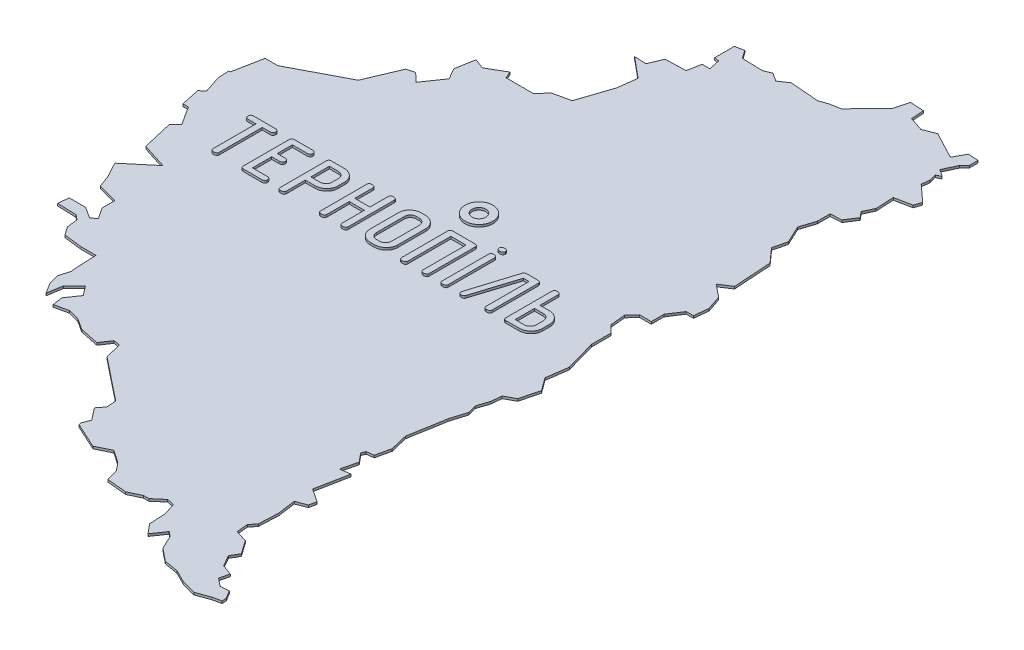
from build123d import *

# Parameters (mm, degrees)
EXTRUDE_1_DEPTH = 5
SKETCH_2_R      = 30
SKETCH_2_R_2    = 15
EXTRUDE_2_DEPTH = 10
SCALE_1_SCALE   = 0.05


with BuildPart() as part:
    # Эскиз1 → Бобышка-Вытянуть1 (new body)
    with BuildSketch(Plane(origin=(0, 0, 0), x_dir=(1, 0, 0), z_dir=(0, 1, 0))):
        Polygon((-3320.1229, 5765.52314), (-3330.51404, 5782.42176), (-3349.31766, 5781.12636), (-3366.19088, 5794.74584), (-3361.00674, 5814.87026), (-3383.7245, 5823.30814), (-3397.34398, 5847.2959), (-3386.95284, 5864.82952), (-3407.07726, 5893.39182), (-3433.02082, 5901.82716), (-3434.97916, 5925.81492), (-3424.58548, 5939.4598), (-3422.65508, 5980.32078), (-3427.83922, 6019.93716), (-3405.78186, 6028.3471), (-3402.52812, 6043.92492), (-3431.09042, 6062.75394), (-3417.44554, 6132.20008), (-3439.5283, 6128.94888), (-3431.09042, 6163.33032), (-3446.66824, 6182.15934), (-3443.4145, 6190.59468), (-3427.83922, 6192.52762), (-3420.69674, 6224.34112), (-3429.76962, 6261.97376), (-3420.69674, 6313.25382), (-3416.17554, 6340.49278), (-3405.78186, 6374.89962), (-3410.966, 6393.70324), (-3402.52812, 6419.0118), (-3400.57232, 6441.09456), (-3378.54036, 6453.41864), (-3368.14922, 6494.27962), (-3388.24824, 6521.54652), (-3381.7687, 6567.6399), (-3400.57232, 6634.46984), (-3400.57232, 6676.65416), (-3416.17554, 6692.20404), (-3419.40134, 6724.65508), (-3403.82606, 6741.52576), (-3378.54036, 6741.52576), (-3378.54036, 6768.79266), (-3359.71134, 6797.98488), (-3344.11066, 6797.98488), (-3340.88232, 6828.4852), (-3351.276, 6859.64592), (-3378.54036, 6881.71852), (-3354.5018, 6897.27348), (-3359.71134, 6979.05132), (-3386.95284, 7009.55164), (-3379.8129, 7038.76164), (-3397.34398, 7076.38666), (-3386.95284, 7108.84278), (-3386.95284, 7136.07666), (-3362.96508, 7137.39238), (-3347.38726, 7161.40046), (-3357.75554, 7173.74486), (-3347.38726, 7195.79206), (-3349.31766, 7234.73788), (-3313.61542, 7241.86766), (-3308.43382, 7257.44548), (-3344.11066, 7289.89144), (-3342.17772, 7306.74942), (-3346.06646, 7322.33486), (-3335.69818, 7326.86114), (-3351.276, 7337.2599), (-3337.63112, 7366.47752), (-3327.26284, 7376.85088), (-3327.26284, 7395.65958), (-3349.31766, 7396.96768), (-3362.96508, 7371.6515), (-3420.69674, 7402.15182), (-3446.66824, 7391.77084), (-3477.16094, 7402.15182), (-3479.11674, 7429.41364), (-3508.32166, 7431.3542), (-3516.757, 7400.86658), (-3571.26286, 7344.3973), (-3593.3253, 7340.5111), (-3612.13908, 7334.01378), (-3673.78996, 7339.20046), (-3693.91184, 7325.5759), (-3711.4353, 7337.2599), (-3728.3136, 7330.76512), (-3772.43086, 7332.0656), (-3784.7651, 7349.5789), (-3803.58142, 7345.70032), (-3803.58142, 7303.50584), (-3793.18266, 7301.57036), (-3788.01122, 7277.56736), (-3804.86412, 7277.56736), (-3810.06604, 7248.35228), (-3854.18584, 7247.05942), (-3866.51754, 7217.84942), (-3892.47888, 7219.15244), (-3886.65212, 7214.59822), (-3847.71138, 7182.16496), (-3852.90568, 7141.2862), (-3876.91122, 7069.24672), (-3914.54386, 7060.81138), (-3931.42724, 7040.69458), (-3991.102, 7040.69458), (-3997.60948, 7055.61454), (-4035.24974, 7033.56734), (-4057.30456, 7041.98998), (-4064.45466, 7001.09852), (-4050.82502, 6977.1006), (-4080.02486, 6934.90866), (-4098.8488, 6953.08236), (-4115.70678, 6948.5383), (-4146.20964, 6876.5166), (-4260.42582, 6816.79866), (-4287.68256, 6816.79866), (-4300.01172, 6753.84984), (-4303.26546, 6753.84984), (-4301.95228, 6729.83668), (-4289.63074, 6692.20404), (-4300.01172, 6683.7941), (-4291.56876, 6642.90772), (-4279.2523, 6642.90772), (-4270.81696, 6629.26284), (-4253.93358, 6603.31674), (-4267.56322, 6589.69726), (-4251.98286, 6523.47692), (-4197.4643, 6505.9941), (-4253.93358, 6458.60278), (-4237.06798, 6427.44968), (-4226.68446, 6400.18278), (-4183.85498, 6388.5191), (-4183.85498, 6361.25474), (-4168.25938, 6337.26698), (-4178.66068, 6328.8037), (-4202.68654, 6344.38152), (-4238.36592, 6344.38152), (-4240.29632, 6321.66376), (-4199.42264, 6320.36836), (-4189.03404, 6311.93302), (-4185.79554, 6287.91986), (-4173.46892, 6270.41164), (-4134.52056, 6265.8625), (-4102.07714, 6265.8625), (-4100.13404, 6224.34112), (-4098.8488, 6209.3983), (-4105.34104, 6185.38514), (-4098.8488, 6163.33032), (-4085.22424, 6141.24756), (-4080.02486, 6173.72146), (-4056.02694, 6197.09962), (-4040.44658, 6176.9498), (-4059.25274, 6149.7083), (-4056.02694, 6127.65348), (-4026.81186, 6134.10762), (-4002.79362, 6127.65348), (-3978.79062, 6112.07566), (-3937.89916, 6103.64032), (-3922.97666, 6125.69514), (-3909.35972, 6123.73934), (-3900.26398, 6088.0371), (-3808.1204, 6014.72762), (-3806.81992, 5993.94026), (-3818.49884, 5979.02538), (-3798.38712, 5953.08182), (-3804.86412, 5936.2086), (-3803.58142, 5931.02446), (-3748.42786, 5905.7159), (-3717.90722, 5920.63078), (-3690.65048, 5901.82716), (-3677.01068, 5884.95394), (-3669.87836, 5859.61998), (-3627.70928, 5855.73124), (-3601.75048, 5868.08072), (-3590.08172, 5868.08072), (-3568.01928, 5886.88434), (-3552.43384, 5883.65854), (-3544.0112, 5857.68958), (-3542.06302, 5821.98734), (-3525.1898, 5801.22538), (-3506.37348, 5828.49228), (-3495.97218, 5820.0544), (-3482.37048, 5790.8317), (-3455.10358, 5768.77688), (-3424.58548, 5763.59274), (-3397.34398, 5749.94786), (-3366.19088, 5741.50998), (-3337.63112, 5751.92906), (-3319.45996, 5755.7924), align=None)
    extrude(amount=EXTRUDE_1_DEPTH)

    # Эскиз2 → Бобышка-Вытянуть2 (add)
    # profile 1 of 11: a face of its own
    with BuildSketch(Plane(origin=(0, 0, 0), x_dir=(1, 0, 0), z_dir=(0, 1, 0))):
        with Locations((-3762.340607285, 6753.252381884)):
            Circle(SKETCH_2_R)
        with Locations((-3762.340607285, 6753.252381884)):
            Circle(SKETCH_2_R_2, mode=Mode.SUBTRACT)
    # profile 2 of 11: a face of its own
    with BuildSketch(Plane(origin=(0, 0, 0), x_dir=(1, 0, 0), z_dir=(0, 1, 0))):
        with BuildLine():
            Line((-4170.036149548, 6679.582542681), (-4187.781081981, 6679.582542681))
            add(Edge.make_bspline(
                [(-4187.781081981, 6679.582542681), (-4188.200828327, 6679.598384207), (-4188.996598969, 6679.628417156), (-4190.106400603, 6679.904019874), (-4191.049244565, 6680.376533147), (-4191.812821275, 6681.055517566), (-4192.431331517, 6681.904459288), (-4192.847685677, 6682.95772022), (-4193.065266496, 6684.187902833), (-4193.103050986, 6685.06310313), (-4193.123142791, 6685.528488627)],
                knots=[0, 0, 0, 0, 1.099344271, 2.084177511, 2.974024668, 3.837303213, 4.738885125, 5.70405988, 6.779139773, 8, 8, 8, 8], degree=3))
            add(Edge.make_bspline(
                [(-4193.123142791, 6685.528488627), (-4193.103050986, 6685.993874124), (-4193.065266496, 6686.869074422), (-4192.847685677, 6688.099257035), (-4192.431331517, 6689.152517966), (-4191.812821275, 6690.001459688), (-4191.049244565, 6690.680444108), (-4190.106400603, 6691.15295738), (-4188.996598969, 6691.428560098), (-4188.200828327, 6691.458593048), (-4187.781081981, 6691.474434573)],
                knots=[0, 0, 0, 0, 1.220860227, 2.29594012, 3.261114875, 4.162696787, 5.025975332, 5.915822489, 6.900655729, 8, 8, 8, 8], degree=3))
            Line((-4187.781081981, 6691.474434573), (-4140.306419818, 6691.474434573))
            add(Edge.make_bspline(
                [(-4140.306419818, 6691.474434573), (-4139.770631248, 6691.459884538), (-4138.768108256, 6691.432659723), (-4137.364579967, 6691.148407714), (-4136.162919764, 6690.699849367), (-4135.173645039, 6690.031445113), (-4134.408335219, 6689.168990841), (-4133.86096206, 6688.118328629), (-4133.570800137, 6686.875191265), (-4133.52521484, 6685.994434789), (-4133.501098872, 6685.528488627)],
                knots=[0, 0, 0, 0, 1.241478992, 2.322952188, 3.306951403, 4.198757046, 5.063935603, 5.955741246, 6.918526805, 8, 8, 8, 8], degree=3))
            add(Edge.make_bspline(
                [(-4133.501098872, 6685.528488627), (-4133.52521484, 6685.062542465), (-4133.570800137, 6684.181785989), (-4133.86096206, 6682.938648626), (-4134.408335219, 6681.887986414), (-4135.173645039, 6681.025532142), (-4136.162919764, 6680.357127888), (-4137.364579967, 6679.908569541), (-4138.768108256, 6679.624317532), (-4139.770631248, 6679.597092717), (-4140.306419818, 6679.582542681)],
                knots=[0, 0, 0, 0, 1.081473195, 2.044258754, 2.936064397, 3.801242954, 4.693048597, 5.677047812, 6.758521008, 8, 8, 8, 8], degree=3))
            Line((-4140.306419818, 6679.582542681), (-4156.65777117, 6679.582542681))
            Line((-4156.65777117, 6679.582542681), (-4156.65777117, 6586.723589979))
            add(Edge.make_bspline(
                [(-4156.65777117, 6586.723589979), (-4156.677253624, 6586.310316247), (-4156.714443056, 6585.521431271), (-4157.074593469, 6584.41973203), (-4157.663302252, 6583.47950466), (-4158.524735618, 6582.744384394), (-4159.590295852, 6582.160519289), (-4160.889696833, 6581.745806074), (-4162.418686627, 6581.532676737), (-4163.508931474, 6581.494688359), (-4164.090203602, 6581.474434573)],
                knots=[0, 0, 0, 0, 0.957214147, 1.827195396, 2.6601552, 3.500842069, 4.426460774, 5.467019893, 6.649522866, 8, 8, 8, 8], degree=3))
            add(Edge.make_bspline(
                [(-4164.090203602, 6581.474434573), (-4164.555493821, 6581.494681406), (-4165.43051494, 6581.53275744), (-4166.661878898, 6581.74841608), (-4167.707103243, 6582.16934975), (-4168.561232095, 6582.759564996), (-4169.248759232, 6583.504385921), (-4169.708866894, 6584.439060975), (-4169.991650016, 6585.530365194), (-4170.020775338, 6586.311340955), (-4170.036149548, 6586.723589979)],
                knots=[0, 0, 0, 0, 1.231142298, 2.315276502, 3.288579949, 4.185921389, 5.041168779, 5.938510218, 6.911813665, 8, 8, 8, 8], degree=3))
            Line((-4170.036149548, 6586.723589979), (-4170.036149548, 6679.582542681))
        make_face()
    # profile 3 of 11: a face of its own
    with BuildSketch(Plane(origin=(0, 0, 0), x_dir=(1, 0, 0), z_dir=(0, 1, 0))):
        with BuildLine():
            Line((-4091.549663062, 6634.987948087), (-4091.549663062, 6593.366326465))
            Line((-4091.549663062, 6593.366326465), (-4059.915372521, 6593.366326465))
            add(Edge.make_bspline(
                [(-4059.915372521, 6593.366326465), (-4059.37998414, 6593.350464604), (-4058.370616604, 6593.320560243), (-4056.961918022, 6593.050642625), (-4055.763820844, 6592.578244841), (-4054.761239426, 6591.932138429), (-4053.994720747, 6591.059812146), (-4053.446495225, 6590.010534281), (-4053.156583521, 6588.76699053), (-4053.110960924, 6587.886294633), (-4053.086825224, 6587.420380519)],
                knots=[0, 0, 0, 0, 1.239032302, 2.335947183, 3.301339876, 4.206248485, 5.069721959, 5.959770044, 6.920658157, 8, 8, 8, 8], degree=3))
            add(Edge.make_bspline(
                [(-4053.086825224, 6587.420380519), (-4053.110960924, 6586.954466405), (-4053.156583521, 6586.073770509), (-4053.446495225, 6584.830226757), (-4053.994720747, 6583.780948893), (-4054.761239426, 6582.90862261), (-4055.763820844, 6582.262516198), (-4056.961918022, 6581.790118414), (-4058.370616604, 6581.520200795), (-4059.37998414, 6581.490296434), (-4059.915372521, 6581.474434573)],
                knots=[0, 0, 0, 0, 1.079341843, 2.040229956, 2.930278041, 3.793751515, 4.698660124, 5.664052817, 6.760967698, 8, 8, 8, 8], degree=3))
            Line((-4059.915372521, 6581.474434573), (-4098.982095494, 6581.474434573))
            add(Edge.make_bspline(
                [(-4098.982095494, 6581.474434573), (-4099.447353918, 6581.494712124), (-4100.322315243, 6581.532845927), (-4101.554073426, 6581.748123694), (-4102.598017928, 6582.170293857), (-4103.461221746, 6582.759686885), (-4104.140677958, 6583.530446712), (-4104.596283298, 6584.479598004), (-4104.886297394, 6585.584122607), (-4104.91353668, 6586.373128189), (-4104.92804144, 6586.793269033)],
                knots=[0, 0, 0, 0, 1.22289028, 2.299757822, 3.266537475, 4.157864275, 5.022578284, 5.932048079, 6.898827733, 8, 8, 8, 8], degree=3))
            Line((-4104.92804144, 6586.793269033), (-4104.92804144, 6686.155600114))
            add(Edge.make_bspline(
                [(-4104.92804144, 6686.155600114), (-4104.91353668, 6686.575740958), (-4104.886297394, 6687.36474654), (-4104.596283298, 6688.469271143), (-4104.140677958, 6689.418422435), (-4103.461221746, 6690.189182261), (-4102.598017928, 6690.778575289), (-4101.554073426, 6691.200745452), (-4100.322315243, 6691.41602322), (-4099.447353918, 6691.454157022), (-4098.982095494, 6691.474434573)],
                knots=[0, 0, 0, 0, 1.101172267, 2.067951921, 2.977421716, 3.842135725, 4.733462525, 5.700242178, 6.77710972, 8, 8, 8, 8], degree=3))
            Line((-4098.982095494, 6691.474434573), (-4059.915372521, 6691.474434573))
            add(Edge.make_bspline(
                [(-4059.915372521, 6691.474434573), (-4059.37998414, 6691.458572712), (-4058.370616604, 6691.428668351), (-4056.961918022, 6691.158750733), (-4055.763820844, 6690.686352949), (-4054.761239426, 6690.040246537), (-4053.994720747, 6689.167920254), (-4053.446495225, 6688.118642389), (-4053.156583521, 6686.875098638), (-4053.110960924, 6685.994402741), (-4053.086825224, 6685.528488627)],
                knots=[0, 0, 0, 0, 1.239032302, 2.335947183, 3.301339876, 4.206248485, 5.069721959, 5.959770044, 6.920658157, 8, 8, 8, 8], degree=3))
            add(Edge.make_bspline(
                [(-4053.086825224, 6685.528488627), (-4053.110960924, 6685.062574514), (-4053.156583521, 6684.181878617), (-4053.446495225, 6682.938334865), (-4053.994720747, 6681.889057001), (-4054.761239426, 6681.016730718), (-4055.763820844, 6680.370624306), (-4056.961918022, 6679.898226522), (-4058.370616604, 6679.628308903), (-4059.37998414, 6679.598404542), (-4059.915372521, 6679.582542681)],
                knots=[0, 0, 0, 0, 1.079341843, 2.040229956, 2.930278041, 3.793751515, 4.698660124, 5.664052817, 6.760967698, 8, 8, 8, 8], degree=3))
            Line((-4059.915372521, 6679.582542681), (-4091.549663062, 6679.582542681))
            Line((-4091.549663062, 6679.582542681), (-4091.549663062, 6646.879839979))
            Line((-4091.549663062, 6646.879839979), (-4075.291217116, 6646.879839979))
            add(Edge.make_bspline(
                [(-4075.291217116, 6646.879839979), (-4074.755828734, 6646.863978118), (-4073.746461198, 6646.834073757), (-4072.337762617, 6646.564156138), (-4071.139665439, 6646.091758354), (-4070.13708402, 6645.445651942), (-4069.370565342, 6644.573325659), (-4068.822339819, 6643.524047795), (-4068.532428115, 6642.280504044), (-4068.486805518, 6641.399808147), (-4068.462669818, 6640.933894033)],
                knots=[0, 0, 0, 0, 1.239032302, 2.335947183, 3.301339876, 4.206248485, 5.069721959, 5.959770044, 6.920658157, 8, 8, 8, 8], degree=3))
            add(Edge.make_bspline(
                [(-4068.462669818, 6640.933894033), (-4068.486805518, 6640.467979919), (-4068.532428115, 6639.587284022), (-4068.822339819, 6638.343740271), (-4069.370565342, 6637.294462406), (-4070.13708402, 6636.422136123), (-4071.139665439, 6635.776029711), (-4072.337762617, 6635.303631927), (-4073.746461198, 6635.033714309), (-4074.755828734, 6635.003809948), (-4075.291217116, 6634.987948087)],
                knots=[0, 0, 0, 0, 1.079341843, 2.040229956, 2.930278041, 3.793751515, 4.698660124, 5.664052817, 6.760967698, 8, 8, 8, 8], degree=3))
            Line((-4075.291217116, 6634.987948087), (-4091.549663062, 6634.987948087))
        make_face()
    # profile 4 of 11: a face of its own
    with BuildSketch(Plane(origin=(0, 0, 0), x_dir=(1, 0, 0), z_dir=(0, 1, 0))):
        with BuildLine():
            Line((-4011.576690089, 6627.555515654), (-4011.576690089, 6586.793269033))
            add(Edge.make_bspline(
                [(-4011.576690089, 6586.793269033), (-4011.59513123, 6586.372014527), (-4011.630025216, 6585.574924562), (-4011.998753487, 6584.461289472), (-4012.581100231, 6583.505474725), (-4013.435687666, 6582.74265732), (-4014.510283185, 6582.161847975), (-4015.808272664, 6581.745379408), (-4017.337710865, 6581.532807712), (-4018.427887018, 6581.494733906), (-4019.009122521, 6581.474434573)],
                knots=[0, 0, 0, 0, 0.969647621, 1.834749252, 2.678145047, 3.526077294, 4.446504318, 5.481227067, 6.657097526, 8, 8, 8, 8], degree=3))
            add(Edge.make_bspline(
                [(-4019.009122521, 6581.474434573), (-4019.474380945, 6581.494712124), (-4020.34934227, 6581.532845927), (-4021.581100453, 6581.748123694), (-4022.625044955, 6582.170293857), (-4023.488248773, 6582.759686885), (-4024.167704985, 6583.530446712), (-4024.623310325, 6584.479598004), (-4024.913324421, 6585.584122607), (-4024.940563707, 6586.373128189), (-4024.955068467, 6586.793269033)],
                knots=[0, 0, 0, 0, 1.22289028, 2.299757822, 3.266537475, 4.157864275, 5.022578284, 5.932048079, 6.898827733, 8, 8, 8, 8], degree=3))
            Line((-4024.955068467, 6586.793269033), (-4024.955068467, 6686.155600114))
            add(Edge.make_bspline(
                [(-4024.955068467, 6686.155600114), (-4024.938686525, 6686.575398792), (-4024.90799535, 6687.361881568), (-4024.644030135, 6688.462421257), (-4024.237558054, 6689.405689167), (-4023.634210951, 6690.186800436), (-4022.842628811, 6690.771668836), (-4021.893829194, 6691.198581253), (-4020.768361821, 6691.417273129), (-4019.969965445, 6691.454527212), (-4019.543328602, 6691.474434573)],
                knots=[0, 0, 0, 0, 1.157077194, 2.167756429, 3.10506564, 3.97280776, 4.857486845, 5.794796055, 6.821611322, 8, 8, 8, 8], degree=3))
            Line((-4019.543328602, 6691.474434573), (-3992.089781305, 6691.474434573))
            add(Edge.make_bspline(
                [(-3992.089781305, 6691.474434573), (-3991.159326913, 6691.454294551), (-3989.33809483, 6691.414873323), (-3986.668441632, 6691.040903849), (-3984.10608727, 6690.513085803), (-3981.677560462, 6689.667757838), (-3979.337567646, 6688.670908172), (-3977.15246713, 6687.35799149), (-3975.046495815, 6685.887580887), (-3973.121492615, 6684.160717648), (-3971.33627823, 6682.325304406), (-3969.782139071, 6680.379073168), (-3968.464978542, 6678.354014913), (-3967.36570633, 6676.269600119), (-3966.519349707, 6674.095776325), (-3965.95081395, 6671.839197636), (-3965.554207395, 6669.523966977), (-3965.515196183, 6667.947815873), (-3965.495609008, 6667.156444708)],
                knots=[0, 0, 0, 0, 1.115359705, 2.183157925, 3.228715987, 4.24774915, 5.262329495, 6.273717254, 7.299288291, 8.338890594, 9.370038504, 10.367862649, 11.320905581, 12.263804873, 13.189908176, 14.111156383, 15.051628764, 16, 16, 16, 16], degree=3))
            Line((-3965.495609008, 6667.156444708), (-3965.495609008, 6651.803826465))
            add(Edge.make_bspline(
                [(-3965.495609008, 6651.803826465), (-3965.51739783, 6651.012816233), (-3965.560550343, 6649.446229542), (-3965.921651657, 6647.134305864), (-3966.501394376, 6644.891857766), (-3967.321904205, 6642.721138736), (-3968.366015911, 6640.623154251), (-3969.668394769, 6638.61296778), (-3971.170062014, 6636.657600864), (-3972.912836682, 6634.824989227), (-3974.783271571, 6633.096071995), (-3976.850427602, 6631.648174052), (-3978.994430259, 6630.363387072), (-3981.287242723, 6629.355760324), (-3983.681279735, 6628.521901544), (-3986.21067827, 6627.985655596), (-3988.842716999, 6627.616745563), (-3990.640664377, 6627.576165428), (-3991.555575224, 6627.555515654)],
                knots=[0, 0, 0, 0, 0.959067182, 1.899421552, 2.831059805, 3.764258791, 4.709244439, 5.667943704, 6.665417502, 7.695258647, 8.732566372, 9.748959613, 10.750800674, 11.759659972, 12.7812896, 13.820296438, 14.890827142, 16, 16, 16, 16], degree=3))
            Line((-3991.555575224, 6627.555515654), (-4011.576690089, 6627.555515654))
        make_face()
        with BuildLine():
            Line((-4011.576690089, 6639.447407546), (-3992.298818467, 6639.447407546))
            add(Edge.make_bspline(
                [(-3992.298818467, 6639.447407546), (-3991.410683453, 6639.487423827), (-3989.665439211, 6639.566058475), (-3987.168478388, 6640.326446837), (-3984.852633531, 6641.509954904), (-3982.803380026, 6643.150668856), (-3981.057864009, 6645.090441674), (-3979.794765588, 6647.30715897), (-3979.020491517, 6649.717124559), (-3978.923219326, 6651.395605207), (-3978.873987386, 6652.245127141)],
                knots=[0, 0, 0, 0, 1.033886494, 2.031655573, 3.017574438, 4.053235711, 5.077365722, 6.044435782, 7.010238993, 8, 8, 8, 8], degree=3))
            Line((-3978.873987386, 6652.245127141), (-3978.873987386, 6666.715144033))
            add(Edge.make_bspline(
                [(-3978.873987386, 6666.715144033), (-3978.923796867, 6667.564329149), (-3979.022210159, 6669.242144314), (-3979.789261582, 6671.660732875), (-3981.090962113, 6673.86635653), (-3982.822129054, 6675.824542592), (-3984.858194525, 6677.508281068), (-3987.175575315, 6678.695824231), (-3989.672108594, 6679.46681821), (-3991.41042077, 6679.543402708), (-3992.298818467, 6679.582542681)],
                knots=[0, 0, 0, 0, 0.988107596, 1.952297418, 2.922249424, 3.951448995, 4.983962972, 5.98039188, 6.967840629, 8, 8, 8, 8], degree=3))
            Line((-3992.298818467, 6679.582542681), (-4011.576690089, 6679.582542681))
            Line((-4011.576690089, 6679.582542681), (-4011.576690089, 6639.447407546))
        make_face(mode=Mode.SUBTRACT)
    # profile 5 of 11: a face of its own
    with BuildSketch(Plane(origin=(0, 0, 0), x_dir=(1, 0, 0), z_dir=(0, 1, 0))):
        with BuildLine():
            Line((-3891.468581981, 6646.879839979), (-3891.468581981, 6686.271731871))
            add(Edge.make_bspline(
                [(-3891.468581981, 6686.271731871), (-3891.454173, 6686.68423533), (-3891.427138367, 6687.458188718), (-3891.136479135, 6688.539293106), (-3890.681750486, 6689.46839126), (-3889.992812688, 6690.210357794), (-3889.145009803, 6690.809862843), (-3888.085293026, 6691.185136569), (-3886.868007415, 6691.455891147), (-3885.989011259, 6691.468006464), (-3885.522636035, 6691.474434573)],
                knots=[0, 0, 0, 0, 1.091529518, 2.047965782, 2.948064081, 3.805939007, 4.706037306, 5.674741692, 6.76627121, 8, 8, 8, 8], degree=3))
            add(Edge.make_bspline(
                [(-3885.522636035, 6691.474434573), (-3884.941400532, 6691.454135241), (-3883.851224378, 6691.416061435), (-3882.321786178, 6691.203489738), (-3881.023796698, 6690.787021171), (-3879.949201179, 6690.206211827), (-3879.094613744, 6689.443394422), (-3878.512267001, 6688.487579675), (-3878.143538729, 6687.373944585), (-3878.108644744, 6686.576854619), (-3878.090203602, 6686.155600114)],
                knots=[0, 0, 0, 0, 1.342902474, 2.518772933, 3.553495682, 4.473922706, 5.321854953, 6.165250748, 7.030352379, 8, 8, 8, 8], degree=3))
            Line((-3878.090203602, 6686.155600114), (-3878.090203602, 6586.793269033))
            add(Edge.make_bspline(
                [(-3878.090203602, 6586.793269033), (-3878.108644744, 6586.372014527), (-3878.143538729, 6585.574924562), (-3878.512267001, 6584.461289472), (-3879.094613744, 6583.505474725), (-3879.949201179, 6582.74265732), (-3881.023796698, 6582.161847975), (-3882.321786178, 6581.745379408), (-3883.851224378, 6581.532807712), (-3884.941400532, 6581.494733906), (-3885.522636035, 6581.474434573)],
                knots=[0, 0, 0, 0, 0.969647621, 1.834749252, 2.678145047, 3.526077294, 4.446504318, 5.481227067, 6.657097526, 8, 8, 8, 8], degree=3))
            add(Edge.make_bspline(
                [(-3885.522636035, 6581.474434573), (-3885.987894459, 6581.494712124), (-3886.862855783, 6581.532845927), (-3888.094613967, 6581.748123694), (-3889.138558468, 6582.170293857), (-3890.001762287, 6582.759686885), (-3890.681218498, 6583.530446712), (-3891.136823839, 6584.479598004), (-3891.426837934, 6585.584122607), (-3891.45407722, 6586.373128189), (-3891.468581981, 6586.793269033)],
                knots=[0, 0, 0, 0, 1.22289028, 2.299757822, 3.266537475, 4.157864275, 5.022578284, 5.932048079, 6.898827733, 8, 8, 8, 8], degree=3))
            Line((-3891.468581981, 6586.793269033), (-3891.468581981, 6634.987948087))
            Line((-3891.468581981, 6634.987948087), (-3924.171284683, 6634.987948087))
            Line((-3924.171284683, 6634.987948087), (-3924.171284683, 6586.793269033))
            add(Edge.make_bspline(
                [(-3924.171284683, 6586.793269033), (-3924.189725825, 6586.372014527), (-3924.22461981, 6585.574924562), (-3924.593348082, 6584.461289472), (-3925.175694825, 6583.505474725), (-3926.03028226, 6582.74265732), (-3927.104877779, 6582.161847975), (-3928.402867259, 6581.745379408), (-3929.93230546, 6581.532807712), (-3931.022481613, 6581.494733906), (-3931.603717116, 6581.474434573)],
                knots=[0, 0, 0, 0, 0.969647621, 1.834749252, 2.678145047, 3.526077294, 4.446504318, 5.481227067, 6.657097526, 8, 8, 8, 8], degree=3))
            add(Edge.make_bspline(
                [(-3931.603717116, 6581.474434573), (-3932.06897554, 6581.494712124), (-3932.943936864, 6581.532845927), (-3934.175695048, 6581.748123694), (-3935.219639549, 6582.170293857), (-3936.082843368, 6582.759686885), (-3936.762299579, 6583.530446712), (-3937.21790492, 6584.479598004), (-3937.507919015, 6585.584122607), (-3937.535158302, 6586.373128189), (-3937.549663062, 6586.793269033)],
                knots=[0, 0, 0, 0, 1.22289028, 2.299757822, 3.266537475, 4.157864275, 5.022578284, 5.932048079, 6.898827733, 8, 8, 8, 8], degree=3))
            Line((-3937.549663062, 6586.793269033), (-3937.549663062, 6686.155600114))
            add(Edge.make_bspline(
                [(-3937.549663062, 6686.155600114), (-3937.535158302, 6686.575740958), (-3937.507919015, 6687.36474654), (-3937.21790492, 6688.469271143), (-3936.762299579, 6689.418422435), (-3936.082843368, 6690.189182261), (-3935.219639549, 6690.778575289), (-3934.175695048, 6691.200745452), (-3932.943936864, 6691.41602322), (-3932.06897554, 6691.454157022), (-3931.603717116, 6691.474434573)],
                knots=[0, 0, 0, 0, 1.101172267, 2.067951921, 2.977421716, 3.842135725, 4.733462525, 5.700242178, 6.77710972, 8, 8, 8, 8], degree=3))
            add(Edge.make_bspline(
                [(-3931.603717116, 6691.474434573), (-3931.021533005, 6691.468196673), (-3929.928024176, 6691.456480107), (-3928.410744278, 6691.186757161), (-3927.099248042, 6690.819111516), (-3926.038954438, 6690.225682012), (-3925.176188558, 6689.493246495), (-3924.593913164, 6688.55797041), (-3924.22434409, 6687.46755988), (-3924.189637811, 6686.68536606), (-3924.171284683, 6686.271731871)],
                knots=[0, 0, 0, 0, 1.353106154, 2.541521659, 3.579288285, 4.507284885, 5.350131461, 6.185231121, 7.040326791, 8, 8, 8, 8], degree=3))
            Line((-3924.171284683, 6686.271731871), (-3924.171284683, 6646.879839979))
            Line((-3924.171284683, 6646.879839979), (-3891.468581981, 6646.879839979))
        make_face()
    # profile 6 of 11: a face of its own
    with BuildSketch(Plane(origin=(0, 0, 0), x_dir=(1, 0, 0), z_dir=(0, 1, 0))):
        with BuildLine():
            add(Edge.make_bspline(
                [(-3790.684798197, 6605.885329844), (-3790.707366726, 6605.086789004), (-3790.752065517, 6603.505214448), (-3791.100997811, 6601.172759603), (-3791.721401424, 6598.920511589), (-3792.550579132, 6596.736670965), (-3793.633401826, 6594.631237249), (-3794.942909008, 6592.603387664), (-3796.485103564, 6590.638973539), (-3798.257202697, 6588.788954516), (-3800.19000102, 6587.062109191), (-3802.294948932, 6585.590501118), (-3804.480567377, 6584.27865458), (-3806.82625659, 6583.275804657), (-3809.265834577, 6582.440381488), (-3811.84155949, 6581.904754951), (-3814.519833785, 6581.535685308), (-3816.348594061, 6581.495088222), (-3817.278970494, 6581.474434573)],
                knots=[0, 0, 0, 0, 0.955175484, 1.891802106, 2.813050817, 3.745408234, 4.681622557, 5.639981446, 6.629481268, 7.664661711, 8.701581189, 9.72450561, 10.733283354, 11.745245447, 12.770431959, 13.813291825, 14.887518622, 16, 16, 16, 16], degree=3))
            Line((-3817.278970494, 6581.474434573), (-3825.129477251, 6581.474434573))
            add(Edge.make_bspline(
                [(-3825.129477251, 6581.474434573), (-3825.974419733, 6581.49792441), (-3827.639638183, 6581.544218342), (-3830.098049683, 6581.876847013), (-3832.467050648, 6582.424830585), (-3834.732736577, 6583.229570889), (-3836.91068823, 6584.225858494), (-3838.979047573, 6585.470479362), (-3840.968816749, 6586.915303528), (-3842.829062728, 6588.578464548), (-3844.538319859, 6590.39246039), (-3846.028376792, 6592.336339366), (-3847.325295201, 6594.351036241), (-3848.338958529, 6596.490552112), (-3849.174169465, 6598.697786703), (-3849.712333536, 6601.018990021), (-3850.082362239, 6603.419206892), (-3850.123429445, 6605.055463418), (-3850.144257656, 6605.885329844)],
                knots=[0, 0, 0, 0, 1.043149238, 2.055845687, 3.05760797, 4.040256608, 5.019784463, 6.010076682, 7.015890737, 8.051962927, 9.086799385, 10.08878973, 11.072786086, 12.039115508, 13.007004251, 13.980870723, 14.97595055, 16, 16, 16, 16], degree=3))
            Line((-3850.144257656, 6605.885329844), (-3850.144257656, 6667.063539303))
            add(Edge.make_bspline(
                [(-3850.144257656, 6667.063539303), (-3850.12323513, 6667.893358606), (-3850.081784788, 6669.529522219), (-3849.715687201, 6671.922965167), (-3849.169836705, 6674.234510526), (-3848.339409938, 6676.435204505), (-3847.325150617, 6678.574545599), (-3846.028498541, 6680.589434995), (-3844.537969815, 6682.532703041), (-3842.830382992, 6684.349024425), (-3840.960522523, 6686.006580407), (-3838.983669036, 6687.488946104), (-3836.890203718, 6688.714870337), (-3834.710488913, 6689.72112671), (-3832.450324704, 6690.519516857), (-3830.091138303, 6691.075293431), (-3827.639489705, 6691.404061257), (-3825.974369754, 6691.450746289), (-3825.129477251, 6691.474434573)],
                knots=[0, 0, 0, 0, 1.024350526, 2.019722912, 2.984584598, 3.952757905, 4.919371433, 5.90365709, 6.905942025, 7.941082731, 8.977459532, 9.989234251, 10.988046002, 11.967861842, 12.950799385, 13.943549883, 14.95654407, 16, 16, 16, 16], degree=3))
            Line((-3825.129477251, 6691.474434573), (-3817.278970494, 6691.474434573))
            add(Edge.make_bspline(
                [(-3817.278970494, 6691.474434573), (-3816.348828657, 6691.452860665), (-3814.520529507, 6691.410454703), (-3811.837248247, 6691.054245218), (-3809.281625263, 6690.472504284), (-3806.830871348, 6689.684709947), (-3804.518552103, 6688.633307481), (-3802.302291654, 6687.368364976), (-3800.222506015, 6685.857917669), (-3798.277436128, 6684.140128118), (-3796.510923691, 6682.278198536), (-3794.94077636, 6680.330235482), (-3793.633794451, 6678.293689676), (-3792.556780032, 6676.194524338), (-3791.711702212, 6674.016018401), (-3791.108259643, 6671.766632504), (-3790.74955633, 6669.436445778), (-3790.706595004, 6667.862231022), (-3790.684798197, 6667.063539303)],
                knots=[0, 0, 0, 0, 1.113057418, 2.187840446, 3.233255027, 4.247266833, 5.263520674, 6.268172433, 7.297024944, 8.334481335, 9.370197792, 10.365962262, 11.324817386, 12.261516479, 13.185708152, 14.116382211, 15.044329928, 16, 16, 16, 16], degree=3))
            Line((-3790.684798197, 6667.063539303), (-3790.684798197, 6605.885329844))
        make_face()
        with BuildLine():
            Line((-3804.063176575, 6606.744704844), (-3804.063176575, 6666.204164303))
            add(Edge.make_bspline(
                [(-3804.063176575, 6666.204164303), (-3804.111084054, 6667.100115402), (-3804.204908478, 6668.854791252), (-3804.98269475, 6671.370671283), (-3806.242507212, 6673.680317976), (-3807.980774479, 6675.705186542), (-3810.022876337, 6677.430935217), (-3812.335321131, 6678.688006467), (-3814.85719604, 6679.431953804), (-3816.600507282, 6679.531741748), (-3817.488007656, 6679.582542681)],
                knots=[0, 0, 0, 0, 1.020875316, 1.999333742, 2.976114742, 4.00461091, 5.027434937, 6.011979822, 6.987921027, 8, 8, 8, 8], degree=3))
            Line((-3817.488007656, 6679.582542681), (-3824.897213737, 6679.582542681))
            add(Edge.make_bspline(
                [(-3824.897213737, 6679.582542681), (-3825.62253308, 6679.537129393), (-3827.083502535, 6679.445655992), (-3829.221009674, 6678.709303398), (-3831.232051615, 6677.485135576), (-3833.11816907, 6675.879148023), (-3834.752445095, 6673.903883949), (-3835.928618305, 6671.572275658), (-3836.644632831, 6668.971315549), (-3836.724626251, 6667.145662943), (-3836.765879278, 6666.204164303)],
                knots=[0, 0, 0, 0, 0.877717203, 1.767935789, 2.706167804, 3.717871189, 4.758407714, 5.790788373, 6.860697959, 8, 8, 8, 8], degree=3))
            Line((-3836.765879278, 6666.204164303), (-3836.765879278, 6606.744704844))
            add(Edge.make_bspline(
                [(-3836.765879278, 6606.744704844), (-3836.72653301, 6605.794956606), (-3836.650847816, 6603.968051979), (-3835.917790256, 6601.365692596), (-3834.760659964, 6599.024914942), (-3833.11601989, 6597.049126192), (-3831.239649817, 6595.435209226), (-3829.219528862, 6594.24991255), (-3827.093723541, 6593.495820249), (-3825.630962573, 6593.409584143), (-3824.897213737, 6593.366326465)],
                knots=[0, 0, 0, 0, 1.148029747, 2.20831245, 3.248494772, 4.28846567, 5.299619101, 6.232592159, 7.113434475, 8, 8, 8, 8], degree=3))
            Line((-3824.897213737, 6593.366326465), (-3817.488007656, 6593.366326465))
            add(Edge.make_bspline(
                [(-3817.488007656, 6593.366326465), (-3816.592812632, 6593.416626935), (-3814.841824842, 6593.515013886), (-3812.310639735, 6594.25934688), (-3810.009596735, 6595.521491852), (-3807.946975333, 6597.21061019), (-3806.244803686, 6599.265682521), (-3804.952055258, 6601.561126614), (-3804.213226319, 6604.099207372), (-3804.113937915, 6605.849741669), (-3804.063176575, 6606.744704844)],
                knots=[0, 0, 0, 0, 1.019985615, 1.995076279, 2.978763126, 3.995073656, 5.017006284, 6.004923721, 6.980014385, 8, 8, 8, 8], degree=3))
        make_face(mode=Mode.SUBTRACT)
    # profile 7 of 11: a face of its own
    with BuildSketch(Plane(origin=(0, 0, 0), x_dir=(1, 0, 0), z_dir=(0, 1, 0))):
        with BuildLine():
            add(Edge.make_bspline(
                [(-3703.279392791, 6586.793269033), (-3703.297833933, 6586.372014527), (-3703.332727919, 6585.574924562), (-3703.70145619, 6584.461289472), (-3704.283802933, 6583.505474725), (-3705.138390368, 6582.74265732), (-3706.212985887, 6582.161847975), (-3707.510975367, 6581.745379408), (-3709.040413568, 6581.532807712), (-3710.130589721, 6581.494733906), (-3710.711825224, 6581.474434573)],
                knots=[0, 0, 0, 0, 0.969647621, 1.834749252, 2.678145047, 3.526077294, 4.446504318, 5.481227067, 6.657097526, 8, 8, 8, 8], degree=3))
            add(Edge.make_bspline(
                [(-3710.711825224, 6581.474434573), (-3711.177115443, 6581.494681406), (-3712.052136561, 6581.53275744), (-3713.283500519, 6581.74841608), (-3714.328724865, 6582.16934975), (-3715.182853717, 6582.759564996), (-3715.870380854, 6583.504385921), (-3716.330488515, 6584.439060975), (-3716.613271638, 6585.530365194), (-3716.64239696, 6586.311340955), (-3716.65777117, 6586.723589979)],
                knots=[0, 0, 0, 0, 1.231142298, 2.315276502, 3.288579949, 4.185921389, 5.041168779, 5.938510218, 6.911813665, 8, 8, 8, 8], degree=3))
            Line((-3716.65777117, 6586.723589979), (-3716.65777117, 6679.582542681))
            Line((-3716.65777117, 6679.582542681), (-3749.360473872, 6679.582542681))
            Line((-3749.360473872, 6679.582542681), (-3749.360473872, 6586.723589979))
            add(Edge.make_bspline(
                [(-3749.360473872, 6586.723589979), (-3749.379956327, 6586.310316247), (-3749.417145759, 6585.521431271), (-3749.777296172, 6584.41973203), (-3750.366004955, 6583.47950466), (-3751.22743832, 6582.744384394), (-3752.292998555, 6582.160519289), (-3753.592399536, 6581.745806074), (-3755.12138933, 6581.532676737), (-3756.211634177, 6581.494688359), (-3756.792906305, 6581.474434573)],
                knots=[0, 0, 0, 0, 0.957214147, 1.827195396, 2.6601552, 3.500842069, 4.426460774, 5.467019893, 6.649522866, 8, 8, 8, 8], degree=3))
            add(Edge.make_bspline(
                [(-3756.792906305, 6581.474434573), (-3757.258164729, 6581.494712124), (-3758.133126053, 6581.532845927), (-3759.364884237, 6581.748123694), (-3760.408828738, 6582.170293857), (-3761.272032557, 6582.759686885), (-3761.951488768, 6583.530446712), (-3762.407094109, 6584.479598004), (-3762.697108204, 6585.584122607), (-3762.724347491, 6586.373128189), (-3762.738852251, 6586.793269033)],
                knots=[0, 0, 0, 0, 1.22289028, 2.299757822, 3.266537475, 4.157864275, 5.022578284, 5.932048079, 6.898827733, 8, 8, 8, 8], degree=3))
            Line((-3762.738852251, 6586.793269033), (-3762.738852251, 6686.155600114))
            add(Edge.make_bspline(
                [(-3762.738852251, 6686.155600114), (-3762.722470309, 6686.575398792), (-3762.691779133, 6687.361881568), (-3762.427813919, 6688.462421257), (-3762.021341837, 6689.405689167), (-3761.417994735, 6690.186800436), (-3760.626412595, 6690.771668836), (-3759.677612978, 6691.198581253), (-3758.552145605, 6691.417273129), (-3757.753749229, 6691.454527212), (-3757.327112386, 6691.474434573)],
                knots=[0, 0, 0, 0, 1.157077194, 2.167756429, 3.10506564, 3.97280776, 4.857486845, 5.794796055, 6.821611322, 8, 8, 8, 8], degree=3))
            Line((-3757.327112386, 6691.474434573), (-3710.177619143, 6691.474434573))
            add(Edge.make_bspline(
                [(-3710.177619143, 6691.474434573), (-3709.635054989, 6691.454409429), (-3708.621788857, 6691.417011455), (-3707.199117399, 6691.202370942), (-3705.995355566, 6690.782030135), (-3704.992414545, 6690.206120582), (-3704.210363272, 6689.431629739), (-3703.679201031, 6688.479557594), (-3703.3378778, 6687.370424165), (-3703.299653387, 6686.576444015), (-3703.279392791, 6686.155600114)],
                knots=[0, 0, 0, 0, 1.311732788, 2.449727646, 3.461545579, 4.37596936, 5.222620336, 6.085851813, 6.985418475, 8, 8, 8, 8], degree=3))
            Line((-3703.279392791, 6686.155600114), (-3703.279392791, 6586.793269033))
        make_face()
    # profile 8 of 11: a face of its own
    with BuildSketch(Plane(origin=(0, 0, 0), x_dir=(1, 0, 0), z_dir=(0, 1, 0))):
        with BuildLine():
            add(Edge.make_bspline(
                [(-3661.955068467, 6586.816495384), (-3661.975032766, 6586.395808084), (-3662.013159197, 6585.5924087), (-3662.365190176, 6584.471028713), (-3662.967417855, 6583.525016198), (-3663.819205652, 6582.768632321), (-3664.881332243, 6582.156144433), (-3666.187826815, 6581.747579247), (-3667.715728313, 6581.53213242), (-3668.806139882, 6581.494499072), (-3669.387500899, 6581.474434573)],
                knots=[0, 0, 0, 0, 0.968349646, 1.849286893, 2.676465977, 3.523263178, 4.451261044, 5.484598709, 6.658895142, 8, 8, 8, 8], degree=3))
            add(Edge.make_bspline(
                [(-3669.387500899, 6581.474434573), (-3669.852886396, 6581.494526378), (-3670.728086694, 6581.532310868), (-3671.958269307, 6581.749891688), (-3673.011530239, 6582.166245848), (-3673.860471961, 6582.78475609), (-3674.53945638, 6583.5483328), (-3675.011969653, 6584.491176762), (-3675.28757237, 6585.600978396), (-3675.31760532, 6586.396749037), (-3675.333446845, 6586.816495384)],
                knots=[0, 0, 0, 0, 1.220860227, 2.29594012, 3.261114875, 4.162696787, 5.025975332, 5.915822489, 6.900655729, 8, 8, 8, 8], degree=3))
            Line((-3675.333446845, 6586.816495384), (-3675.333446845, 6686.829164303))
            add(Edge.make_bspline(
                [(-3675.333446845, 6686.829164303), (-3675.317429528, 6687.248742345), (-3675.287063305, 6688.04419391), (-3675.013689804, 6689.156129809), (-3674.531052628, 6690.097119052), (-3673.876299285, 6690.88637081), (-3673.002017195, 6691.474269499), (-3671.959914306, 6691.897875522), (-3670.727588858, 6692.112711007), (-3669.852713572, 6692.150911892), (-3669.387500899, 6692.171225114)],
                knots=[0, 0, 0, 0, 1.098843442, 2.08322802, 2.972669788, 3.850929026, 4.740370794, 5.705105844, 6.779695961, 8, 8, 8, 8], degree=3))
            add(Edge.make_bspline(
                [(-3669.387500899, 6692.171225114), (-3668.806323977, 6692.15086938), (-3667.7162577, 6692.112689786), (-3666.186102277, 6691.900808627), (-3664.890370479, 6691.482166377), (-3663.803931678, 6690.905748334), (-3662.975498957, 6690.118982503), (-3662.363725656, 6689.176360056), (-3662.01357856, 6688.052755868), (-3661.97517689, 6687.249681443), (-3661.955068467, 6686.829164303)],
                knots=[0, 0, 0, 0, 1.340544031, 2.514349394, 3.547254935, 4.466065479, 5.324653274, 6.151486447, 7.032055301, 8, 8, 8, 8], degree=3))
            Line((-3661.955068467, 6686.829164303), (-3661.955068467, 6586.816495384))
        make_face()
    # profile 9 of 11: a face of its own
    with BuildSketch(Plane(origin=(0, 0, 0), x_dir=(1, 0, 0), z_dir=(0, 1, 0))):
        with BuildLine():
            add(Edge.make_bspline(
                [(-3669.387500899, 6715.258218357), (-3668.806265396, 6715.237919025), (-3667.716089243, 6715.199845218), (-3666.186651043, 6714.987273522), (-3664.888661563, 6714.570804955), (-3663.814066044, 6713.98999561), (-3662.959478609, 6713.227178206), (-3662.377131866, 6712.271363459), (-3662.008403594, 6711.157728369), (-3661.973509608, 6710.360638403), (-3661.955068467, 6709.939383898)],
                knots=[0, 0, 0, 0, 1.342902474, 2.518772933, 3.553495682, 4.473922706, 5.321854953, 6.165250748, 7.030352379, 8, 8, 8, 8], degree=3))
            add(Edge.make_bspline(
                [(-3661.955068467, 6709.939383898), (-3661.974029149, 6709.510756162), (-3662.009927915, 6708.699223778), (-3662.370226422, 6707.56546646), (-3662.967189249, 6706.605404253), (-3663.805006098, 6705.817346582), (-3664.889800265, 6705.238167574), (-3666.188522357, 6704.828000164), (-3667.713530652, 6704.577169362), (-3668.805805136, 6704.544853822), (-3669.387500899, 6704.527644033)],
                knots=[0, 0, 0, 0, 0.981339183, 1.857995784, 2.696169867, 3.550943068, 4.465671455, 5.493987931, 6.665411832, 8, 8, 8, 8], degree=3))
            add(Edge.make_bspline(
                [(-3669.387500899, 6704.527644033), (-3669.853338207, 6704.544904815), (-3670.730921413, 6704.577422118), (-3671.956976364, 6704.830777939), (-3673.002578143, 6705.246057859), (-3673.875445783, 6705.836527793), (-3674.538412113, 6706.628810939), (-3675.00776885, 6707.584566757), (-3675.290207093, 6708.70806399), (-3675.318431142, 6709.511788147), (-3675.333446845, 6709.939383898)],
                knots=[0, 0, 0, 0, 1.213876563, 2.286801999, 3.246455683, 4.131212664, 5.004846013, 5.90761226, 6.886811976, 8, 8, 8, 8], degree=3))
            add(Edge.make_bspline(
                [(-3675.333446845, 6709.939383898), (-3675.318942085, 6710.359524742), (-3675.291702799, 6711.148530324), (-3675.001688703, 6712.253054926), (-3674.546083363, 6713.202206219), (-3673.866627151, 6713.972966045), (-3673.003423333, 6714.562359073), (-3671.959478832, 6714.984529236), (-3670.727720648, 6715.199807004), (-3669.852759323, 6715.237940806), (-3669.387500899, 6715.258218357)],
                knots=[0, 0, 0, 0, 1.101172267, 2.067951921, 2.977421716, 3.842135725, 4.733462525, 5.700242178, 6.77710972, 8, 8, 8, 8], degree=3))
        make_face()
    # profile 10 of 11: a face of its own
    with BuildSketch(Plane(origin=(0, 0, 0), x_dir=(1, 0, 0), z_dir=(0, 1, 0))):
        with BuildLine():
            add(Edge.make_bspline(
                [(-3567.117230629, 6586.793269033), (-3567.135671771, 6586.372014527), (-3567.170565756, 6585.574924562), (-3567.539294028, 6584.461289472), (-3568.121640771, 6583.505474725), (-3568.976228206, 6582.74265732), (-3570.050823725, 6582.161847975), (-3571.348813205, 6581.745379408), (-3572.878251405, 6581.532807712), (-3573.968427559, 6581.494733906), (-3574.549663062, 6581.474434573)],
                knots=[0, 0, 0, 0, 0.969647621, 1.834749252, 2.678145047, 3.526077294, 4.446504318, 5.481227067, 6.657097526, 8, 8, 8, 8], degree=3))
            add(Edge.make_bspline(
                [(-3574.549663062, 6581.474434573), (-3575.014953281, 6581.494681406), (-3575.889974399, 6581.53275744), (-3577.121338357, 6581.74841608), (-3578.166562703, 6582.16934975), (-3579.020691554, 6582.759564996), (-3579.708218692, 6583.504385921), (-3580.168326353, 6584.439060975), (-3580.451109476, 6585.530365194), (-3580.480234798, 6586.311340955), (-3580.495609008, 6586.723589979)],
                knots=[0, 0, 0, 0, 1.231142298, 2.315276502, 3.288579949, 4.185921389, 5.041168779, 5.938510218, 6.911813665, 8, 8, 8, 8], degree=3))
            Line((-3580.495609008, 6586.723589979), (-3580.495609008, 6679.582542681))
            Line((-3580.495609008, 6679.582542681), (-3592.805575224, 6679.582542681))
            Line((-3592.805575224, 6679.582542681), (-3622.488852251, 6585.213877141))
            add(Edge.make_bspline(
                [(-3622.488852251, 6585.213877141), (-3622.726470063, 6584.644645849), (-3623.197234166, 6583.516895129), (-3624.669274798, 6582.27339477), (-3626.618848174, 6581.572241545), (-3628.064191034, 6581.508963538), (-3628.852872521, 6581.474434573)],
                knots=[0, 0, 0, 0, 0.920783868, 1.824240315, 2.812751332, 4, 4, 4, 4], degree=3))
            add(Edge.make_bspline(
                [(-3628.852872521, 6581.474434573), (-3629.286944806, 6581.49533858), (-3630.107674021, 6581.534863169), (-3631.266768693, 6581.744532936), (-3632.23513737, 6582.18114218), (-3633.066113074, 6582.734950414), (-3633.676597653, 6583.515073148), (-3634.12284742, 6584.432301885), (-3634.378090699, 6585.518109705), (-3634.410096085, 6586.288654651), (-3634.427196845, 6586.700363627)],
                knots=[0, 0, 0, 0, 1.192508042, 2.254753928, 3.205852217, 4.08983164, 4.9656069, 5.887070154, 6.871042903, 8, 8, 8, 8], degree=3))
            add(Edge.make_bspline(
                [(-3634.427196845, 6586.700363627), (-3634.40364524, 6586.988021281), (-3634.35613739, 6587.568278812), (-3634.218091475, 6588.133896179), (-3634.148480629, 6588.419113627)],
                knots=[0, 0, 0, 0, 0.991482704, 2, 2, 2, 2], degree=3))
            Line((-3634.148480629, 6588.419113627), (-3603.303886035, 6687.734992006))
            add(Edge.make_bspline(
                [(-3603.303886035, 6687.734992006), (-3603.083086559, 6688.296397199), (-3602.662466424, 6689.365866805), (-3601.486330676, 6690.629445109), (-3599.922100696, 6691.364158643), (-3598.775016035, 6691.436390861), (-3598.170862386, 6691.474434573)],
                knots=[0, 0, 0, 0, 1.049874067, 1.999996468, 2.94662576, 4, 4, 4, 4], degree=3))
            Line((-3598.170862386, 6691.474434573), (-3574.549663062, 6691.474434573))
            add(Edge.make_bspline(
                [(-3574.549663062, 6691.474434573), (-3573.968427559, 6691.454135241), (-3572.878251405, 6691.416061435), (-3571.348813205, 6691.203489738), (-3570.050823725, 6690.787021171), (-3568.976228206, 6690.206211827), (-3568.121640771, 6689.443394422), (-3567.539294028, 6688.487579675), (-3567.170565756, 6687.373944585), (-3567.135671771, 6686.576854619), (-3567.117230629, 6686.155600114)],
                knots=[0, 0, 0, 0, 1.342902474, 2.518772933, 3.553495682, 4.473922706, 5.321854953, 6.165250748, 7.030352379, 8, 8, 8, 8], degree=3))
            Line((-3567.117230629, 6686.155600114), (-3567.117230629, 6586.793269033))
        make_face()
    # profile 11 of 11: a face of its own
    with BuildSketch(Plane(origin=(0, 0, 0), x_dir=(1, 0, 0), z_dir=(0, 1, 0))):
        with BuildLine():
            add(Edge.make_bspline(
                [(-3478.225338737, 6606.396309573), (-3478.247881359, 6605.582317072), (-3478.292533, 6603.969989023), (-3478.642987354, 6601.583843271), (-3479.263923441, 6599.281491374), (-3480.061248032, 6597.034162235), (-3481.153243823, 6594.889436178), (-3482.455766452, 6592.804649576), (-3484.021573713, 6590.820624936), (-3485.770218692, 6588.916998306), (-3487.715623259, 6587.194065839), (-3489.778527911, 6585.637548236), (-3491.997317328, 6584.369255056), (-3494.322421781, 6583.313215696), (-3496.766741652, 6582.463316613), (-3499.348587279, 6581.900975095), (-3502.045127129, 6581.535950387), (-3503.881473393, 6581.495233479), (-3504.819511035, 6581.474434573)],
                knots=[0, 0, 0, 0, 0.963633486, 1.908731712, 2.847047916, 3.78375066, 4.726667904, 5.690606565, 6.689985837, 7.714895885, 8.747199612, 9.762926321, 10.769218895, 11.7661145, 12.783659731, 13.826693924, 14.88983742, 16, 16, 16, 16], degree=3))
            Line((-3504.819511035, 6581.474434573), (-3532.273058332, 6581.474434573))
            add(Edge.make_bspline(
                [(-3532.273058332, 6581.474434573), (-3532.699695175, 6581.494341934), (-3533.498091551, 6581.531596018), (-3534.623558923, 6581.750287894), (-3535.572358541, 6582.177200311), (-3536.363940681, 6582.76206871), (-3536.967287783, 6583.54317998), (-3537.373759865, 6584.48644789), (-3537.637725079, 6585.586987579), (-3537.668416255, 6586.373470355), (-3537.684798197, 6586.793269033)],
                knots=[0, 0, 0, 0, 1.178388678, 2.205203945, 3.142513155, 4.02719224, 4.89493436, 5.832243571, 6.842922806, 8, 8, 8, 8], degree=3))
            Line((-3537.684798197, 6586.793269033), (-3537.684798197, 6686.155600114))
            add(Edge.make_bspline(
                [(-3537.684798197, 6686.155600114), (-3537.670293437, 6686.575740958), (-3537.64305415, 6687.36474654), (-3537.353040055, 6688.469271143), (-3536.897434714, 6689.418422435), (-3536.217978503, 6690.189182261), (-3535.354774684, 6690.778575289), (-3534.310830183, 6691.200745452), (-3533.079071999, 6691.41602322), (-3532.204110675, 6691.454157022), (-3531.738852251, 6691.474434573)],
                knots=[0, 0, 0, 0, 1.101172267, 2.067951921, 2.977421716, 3.842135725, 4.733462525, 5.700242178, 6.77710972, 8, 8, 8, 8], degree=3))
            add(Edge.make_bspline(
                [(-3531.738852251, 6691.474434573), (-3531.15666814, 6691.468196673), (-3530.063159311, 6691.456480107), (-3528.545879413, 6691.186757161), (-3527.234383177, 6690.819111516), (-3526.174089573, 6690.225682012), (-3525.311323693, 6689.493246495), (-3524.729048299, 6688.55797041), (-3524.359479225, 6687.46755988), (-3524.324772947, 6686.68536606), (-3524.306419818, 6686.271731871)],
                knots=[0, 0, 0, 0, 1.353106154, 2.541521659, 3.579288285, 4.507284885, 5.350131461, 6.185231121, 7.040326791, 8, 8, 8, 8], degree=3))
            Line((-3524.306419818, 6686.271731871), (-3524.306419818, 6646.879839979))
            Line((-3524.306419818, 6646.879839979), (-3504.285304954, 6646.879839979))
            add(Edge.make_bspline(
                [(-3504.285304954, 6646.879839979), (-3503.370774796, 6646.857636517), (-3501.573575533, 6646.814003133), (-3498.932657896, 6646.466708703), (-3496.419685763, 6645.848630684), (-3494.003697485, 6645.048568063), (-3491.73194296, 6643.967926244), (-3489.563213368, 6642.678272998), (-3487.521930697, 6641.145850177), (-3485.630286892, 6639.380335989), (-3483.916147259, 6637.475853921), (-3482.379814054, 6635.49311331), (-3481.110119404, 6633.423071444), (-3480.043830844, 6631.291447436), (-3479.232219629, 6629.077561671), (-3478.650988439, 6626.789780705), (-3478.290397758, 6624.431413639), (-3478.247165694, 6622.834096019), (-3478.225338737, 6622.027644033)],
                knots=[0, 0, 0, 0, 1.096850268, 2.155487685, 3.187140075, 4.197419692, 5.202821391, 6.198265597, 7.219836451, 8.258155485, 9.297055814, 10.290809041, 11.262444892, 12.205247722, 13.145485597, 14.084759807, 15.03303561, 16, 16, 16, 16], degree=3))
            Line((-3478.225338737, 6622.027644033), (-3478.225338737, 6606.396309573))
        make_face()
        with BuildLine():
            Line((-3491.603717116, 6606.767931195), (-3491.603717116, 6621.656022411))
            add(Edge.make_bspline(
                [(-3491.603717116, 6621.656022411), (-3491.653302448, 6622.536113191), (-3491.751246189, 6624.274518072), (-3492.517149516, 6626.771793686), (-3493.79117799, 6629.065359525), (-3495.519326164, 6631.089789319), (-3497.57035432, 6632.808375179), (-3499.86881831, 6634.0985659), (-3502.398631827, 6634.835747293), (-3504.141349833, 6634.936603376), (-3505.028548197, 6634.987948087)],
                knots=[0, 0, 0, 0, 1.005936902, 1.986983231, 2.958581705, 3.989798119, 5.015327389, 6.006721754, 6.985244203, 8, 8, 8, 8], degree=3))
            Line((-3505.028548197, 6634.987948087), (-3524.306419818, 6634.987948087))
            Line((-3524.306419818, 6634.987948087), (-3524.306419818, 6593.366326465))
            Line((-3524.306419818, 6593.366326465), (-3505.028548197, 6593.366326465))
            add(Edge.make_bspline(
                [(-3505.028548197, 6593.366326465), (-3504.133264504, 6593.416520138), (-3502.38210328, 6593.514698196), (-3499.852178716, 6594.260549452), (-3497.541940003, 6595.519241107), (-3495.495093653, 6597.235338995), (-3493.784204892, 6599.287536016), (-3492.492890479, 6601.584708044), (-3491.753689641, 6604.122340678), (-3491.654452332, 6605.872936543), (-3491.603717116, 6606.767931195)],
                knots=[0, 0, 0, 0, 1.019269311, 1.9936752, 2.976671234, 3.99788619, 5.019101147, 6.0063248, 6.980730689, 8, 8, 8, 8], degree=3))
        make_face(mode=Mode.SUBTRACT)
    extrude(amount=EXTRUDE_2_DEPTH)


with BuildPart() as part_1:
    # Масштаб1: scaled about (-3743.261418009, 2.630323286, -6618.218030579)
    add(part.part.scale(SCALE_1_SCALE).moved(Location((-3556.098347109, 2.498807122, -6287.30712905))))


solid = part_1.part
